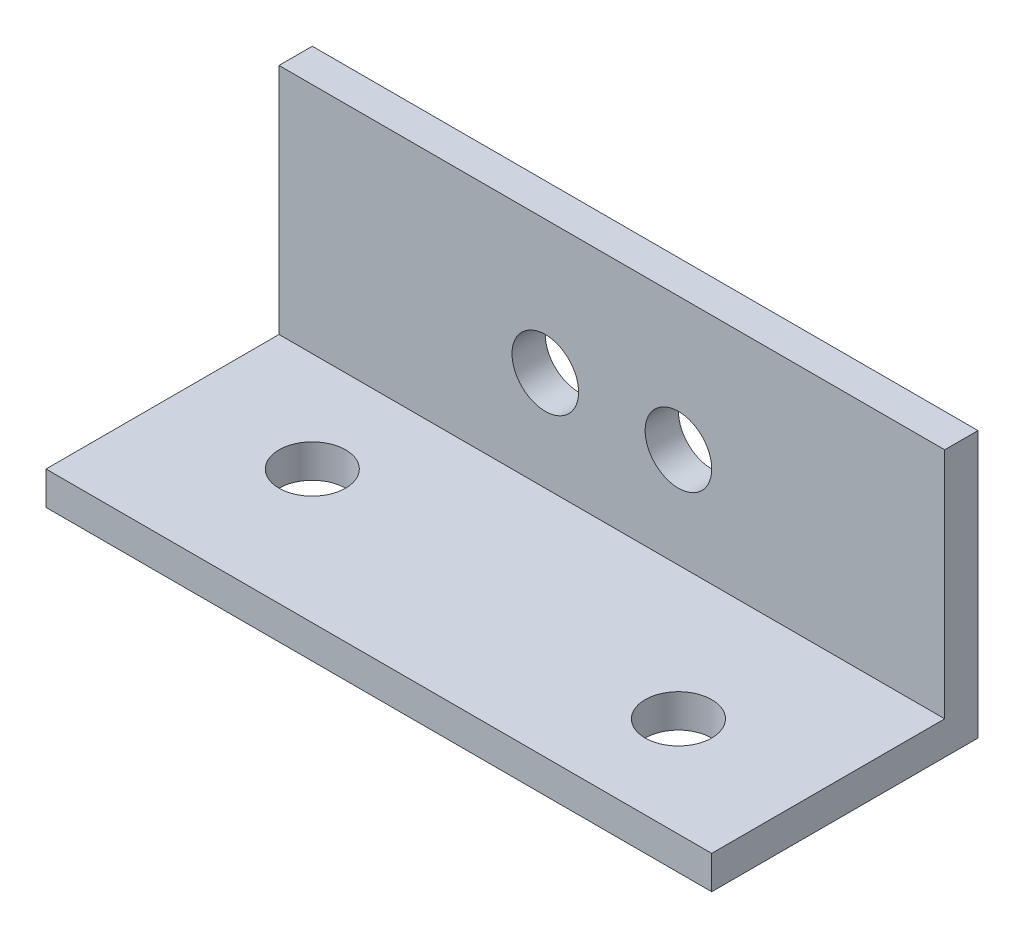
from build123d import *

# Parameters (mm, degrees)
SKETCH1_W           = 63.5
SKETCH1_H           = 25.4
BOSS_EXTRUDE1_DEPTH = 3.175
SKETCH2_W           = 63.5
SKETCH2_H           = 3.175
BOSS_EXTRUDE2_DEPTH = 22.225
SKETCH3_R           = 3.175
CUT_EXTRUDE1_DEPTH  = 3.175
SKETCH4_R           = 3.175
CUT_EXTRUDE2_DEPTH  = 3.175


with BuildPart() as part:
    # Sketch1 → Boss-Extrude1 (new body)
    with BuildSketch(Plane(origin=(0, 0, 0), x_dir=(1, 0, 0), z_dir=(0, 1, 0))):
        Rectangle(SKETCH1_W, SKETCH1_H)
    extrude(amount=BOSS_EXTRUDE1_DEPTH)

    # Sketch2 → Boss-Extrude2 (add)
    with BuildSketch(Plane(origin=(0, 3.175, 0), x_dir=(1, 0, 0), z_dir=(0, 1, 0))):
        with Locations((0, 11.1125)):
            Rectangle(SKETCH2_W, SKETCH2_H)
    extrude(amount=BOSS_EXTRUDE2_DEPTH)

    # Sketch3 → Cut-Extrude1 (cut)
    with BuildSketch(Plane.XY.offset(-9.525)):
        with Locations((-6.35, 12.7)):
            Circle(SKETCH3_R)
        with Locations((6.35, 12.7)):
            Circle(SKETCH3_R)
    extrude(amount=-CUT_EXTRUDE1_DEPTH, mode=Mode.SUBTRACT)

    # Sketch4 → Cut-Extrude2 (cut)
    with BuildSketch(Plane(origin=(0, 3.175, 0), x_dir=(1, 0, 0), z_dir=(0, 1, 0))):
        with Locations((-19.05, 0)):
            Circle(SKETCH4_R)
        with Locations((19.05, -3.175)):
            Circle(SKETCH4_R)
    extrude(amount=-CUT_EXTRUDE2_DEPTH, mode=Mode.SUBTRACT)


solid = part.part
